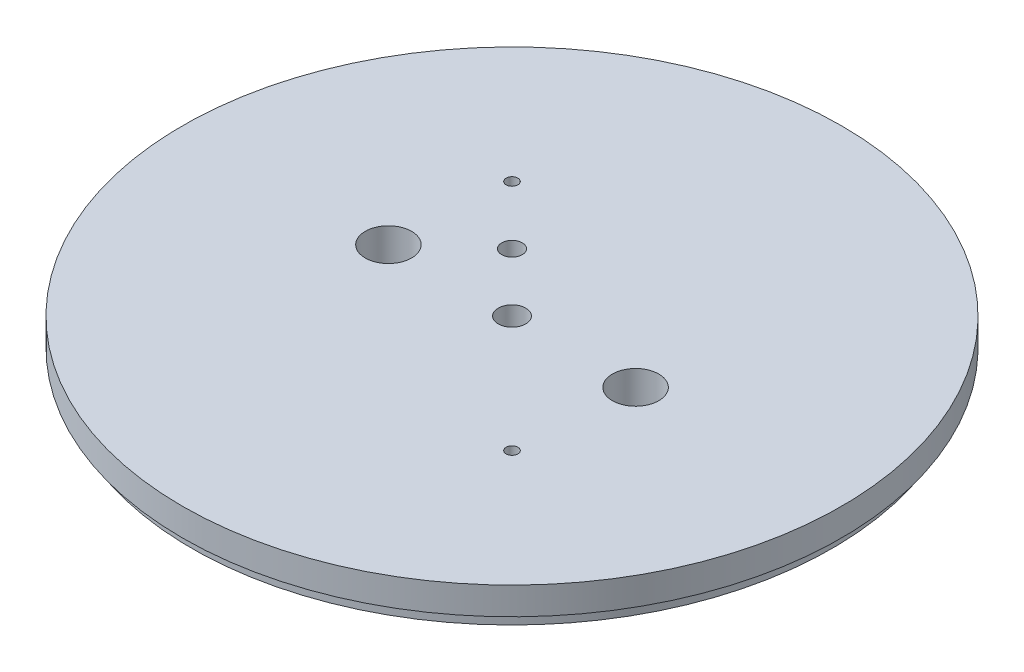
from build123d import *

# Parameters (mm, degrees)
SKETCH1_R           = 76.2
SKETCH1_R_2         = 3.175
SKETCH1_R_3         = 5.3578125
SKETCH1_R_4         = 1.3589
SKETCH1_R_5         = 2.38125
BOSS_EXTRUDE1_DEPTH = 9.525
SKETCH2_R           = 76.2
SKETCH2_R_2         = 74.041
CUT_EXTRUDE1_DEPTH  = 3.175
CUT_EXTRUDE2_START  = -5.969
CUT_EXTRUDE2_DEPTH  = 3.556


with BuildPart() as part:
    # Sketch1 → Boss-Extrude1 (new body)
    with BuildSketch(Plane(origin=(0, 0, 0), x_dir=(1, 0, 0), z_dir=(0, 1, 0))):
        Circle(SKETCH1_R)
        Circle(SKETCH1_R_2, mode=Mode.SUBTRACT)
        with Locations((28.575, 0)):
            Circle(SKETCH1_R_3, mode=Mode.SUBTRACT)
        with Locations((-28.575, 0)):
            Circle(SKETCH1_R_3, mode=Mode.SUBTRACT)
        with Locations((-26.940768363, 26.940768363)):
            Circle(SKETCH1_R_4, mode=Mode.SUBTRACT)
        with Locations((26.940768363, -26.940768363)):
            Circle(SKETCH1_R_4, mode=Mode.SUBTRACT)
        with Locations((-13.470384182, 13.470384182)):
            Circle(SKETCH1_R_5, mode=Mode.SUBTRACT)
    extrude(amount=BOSS_EXTRUDE1_DEPTH)

    # Sketch2 → Cut-Extrude1 (cut)
    with BuildSketch(Plane.XZ):
        Circle(SKETCH2_R)
        Circle(SKETCH2_R_2, mode=Mode.SUBTRACT)
    extrude(amount=-CUT_EXTRUDE1_DEPTH, mode=Mode.SUBTRACT)

    # Sketch3 → Cut-Extrude2 (cut)
    with BuildSketch(Plane(origin=(0, 9.525, 0), x_dir=(1, 0, 0), z_dir=(0, 1, 0)).offset(CUT_EXTRUDE2_START)):
        with BuildLine():
            Line((3.2385, 34.798), (3.2385, 13.97))
            ThreePointArc((3.2385, 13.97), (0, 10.7315), (-3.2385, 13.97))
            Line((-3.2385, 13.97), (-3.2385, 34.798))
            ThreePointArc((-3.2385, 34.798), (0, 38.0365), (3.2385, 34.798))
        make_face()
        with BuildLine():
            Line((3.2385, -34.798), (3.2385, -13.97))
            ThreePointArc((3.2385, -13.97), (0, -10.7315), (-3.2385, -13.97))
            Line((-3.2385, -13.97), (-3.2385, -34.798))
            ThreePointArc((-3.2385, -34.798), (0, -38.0365), (3.2385, -34.798))
        make_face()
    extrude(amount=-CUT_EXTRUDE2_DEPTH, mode=Mode.SUBTRACT)


solid = part.part
